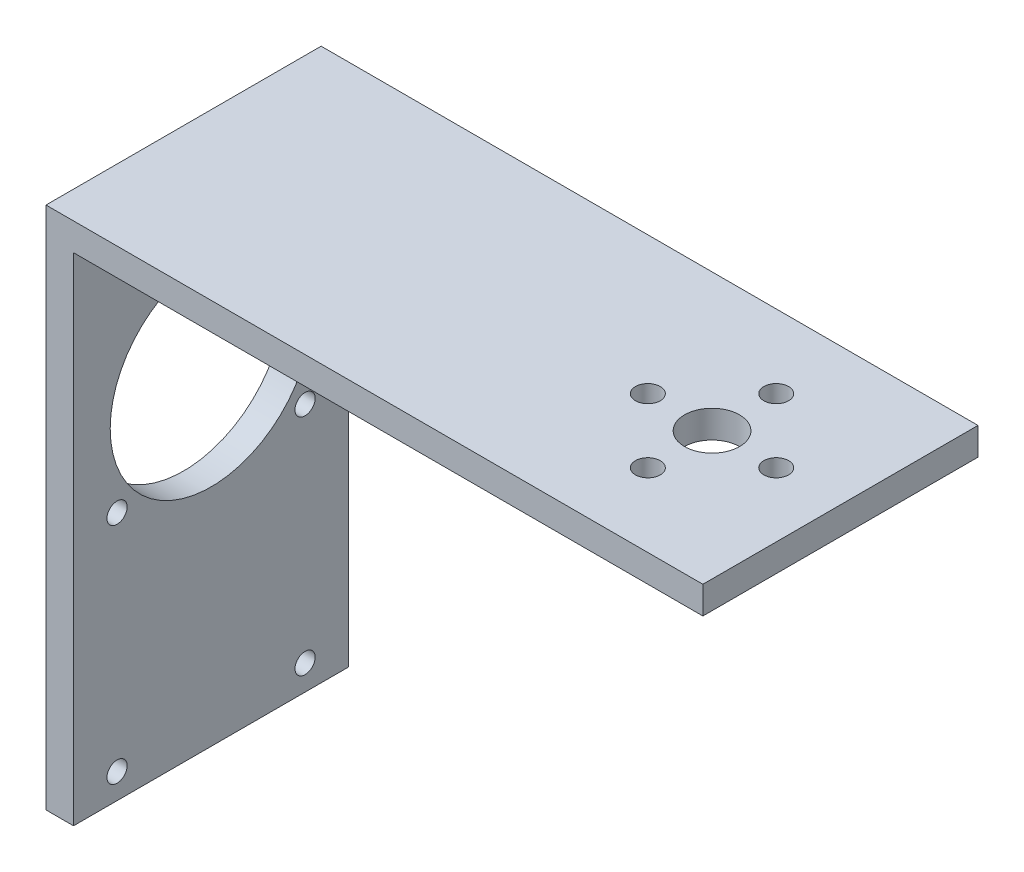
from build123d import *

# Parameters (mm, degrees)
S_BOX1_W      = 71.625
S_BOX1_H      = 3
BOSS_1_DEPTH  = 30
S_BOX2_W      = 3
S_BOX2_H      = 54.625
BOSS_2_DEPTH  = 30
S_BOX3_W      = 31.125
S_BOX3_H      = 3.5
BOSS_3_DEPTH  = 3
S_HOLE4_R     = 3
HOLE_4_DEPTH  = 3.2
S_HOLE5_R     = 1.35
HOLE_5_DEPTH  = 3.2
S_HOLE6_R     = 1.35
HOLE_6_DEPTH  = 3.2
S_HOLE7_R     = 1.35
HOLE_7_DEPTH  = 3.2
S_HOLE8_R     = 1.35
HOLE_8_DEPTH  = 3.2
S_HOLE9_R     = 11
HOLE_9_DEPTH  = 3.2
S_HOLE10_R    = 1.1
HOLE_10_DEPTH = 3.2
S_HOLE11_R    = 1.1
HOLE_11_DEPTH = 3.2
S_HOLE12_R    = 1.1
HOLE_12_DEPTH = 3.2
S_HOLE13_R    = 1.1
HOLE_13_DEPTH = 3.2


with BuildPart() as part:
    # S_box1 → Boss_1 (new body)
    with BuildSketch(Plane.XY.offset(-15)):
        with Locations((-21.8125, 20.125)):
            Rectangle(S_BOX1_W, S_BOX1_H)
    extrude(amount=BOSS_1_DEPTH)

    # S_box2 → Boss_2 (add)
    with BuildSketch(Plane.XY.offset(-15)):
        with Locations((-56.125, -8.1875)):
            Rectangle(S_BOX2_W, S_BOX2_H)
    extrude(amount=BOSS_2_DEPTH)

    # S_box3 → Boss_3 (add)
    with BuildSketch(Plane.XY.offset(-15)):
        with Locations((-39.5625, 17.375)):
            Rectangle(S_BOX3_W, S_BOX3_H)
    extrude(amount=BOSS_3_DEPTH)

    # S_hole4 → Hole_4 (cut)
    with BuildSketch(Plane(origin=(0, 18.525, 0), x_dir=(1, 0, 0), z_dir=(0, 1, 0))):
        Circle(S_HOLE4_R)
    extrude(amount=HOLE_4_DEPTH, mode=Mode.SUBTRACT)

    # S_hole5 → Hole_5 (cut)
    with BuildSketch(Plane(origin=(0, 18.525, 0), x_dir=(1, 0, 0), z_dir=(0, 1, 0))):
        with Locations((7, 0)):
            Circle(S_HOLE5_R)
    extrude(amount=HOLE_5_DEPTH, mode=Mode.SUBTRACT)

    # S_hole6 → Hole_6 (cut)
    with BuildSketch(Plane(origin=(0, 18.525, 0), x_dir=(1, 0, 0), z_dir=(0, 1, 0))):
        with Locations((0, -7)):
            Circle(S_HOLE6_R)
    extrude(amount=HOLE_6_DEPTH, mode=Mode.SUBTRACT)

    # S_hole7 → Hole_7 (cut)
    with BuildSketch(Plane(origin=(0, 18.525, 0), x_dir=(1, 0, 0), z_dir=(0, 1, 0))):
        with Locations((-7, 0)):
            Circle(S_HOLE7_R)
    extrude(amount=HOLE_7_DEPTH, mode=Mode.SUBTRACT)

    # S_hole8 → Hole_8 (cut)
    with BuildSketch(Plane(origin=(0, 18.525, 0), x_dir=(1, 0, 0), z_dir=(0, 1, 0))):
        with Locations((0, 7)):
            Circle(S_HOLE8_R)
    extrude(amount=HOLE_8_DEPTH, mode=Mode.SUBTRACT)

    # S_hole9 → Hole_9 (cut)
    with BuildSketch(Plane(origin=(-57.725, 0, 0), x_dir=(0, 0, -1), z_dir=(1, 0, 0))):
        Circle(S_HOLE9_R)
    extrude(amount=HOLE_9_DEPTH, mode=Mode.SUBTRACT)

    # S_hole10 → Hole_10 (cut)
    with BuildSketch(Plane(origin=(-57.725, 0, 0), x_dir=(0, 0, -1), z_dir=(1, 0, 0))):
        with Locations((10.25, -8.3)):
            Circle(S_HOLE10_R)
    extrude(amount=HOLE_10_DEPTH, mode=Mode.SUBTRACT)

    # S_hole11 → Hole_11 (cut)
    with BuildSketch(Plane(origin=(-57.725, 0, 0), x_dir=(0, 0, -1), z_dir=(1, 0, 0))):
        with Locations((-10.25, -8.3)):
            Circle(S_HOLE11_R)
    extrude(amount=HOLE_11_DEPTH, mode=Mode.SUBTRACT)

    # S_hole12 → Hole_12 (cut)
    with BuildSketch(Plane(origin=(-57.725, 0, 0), x_dir=(0, 0, -1), z_dir=(1, 0, 0))):
        with Locations((10.25, -32.75)):
            Circle(S_HOLE12_R)
    extrude(amount=HOLE_12_DEPTH, mode=Mode.SUBTRACT)

    # S_hole13 → Hole_13 (cut)
    with BuildSketch(Plane(origin=(-57.725, 0, 0), x_dir=(0, 0, -1), z_dir=(1, 0, 0))):
        with Locations((-10.25, -32.75)):
            Circle(S_HOLE13_R)
    extrude(amount=HOLE_13_DEPTH, mode=Mode.SUBTRACT)


solid = part.part
